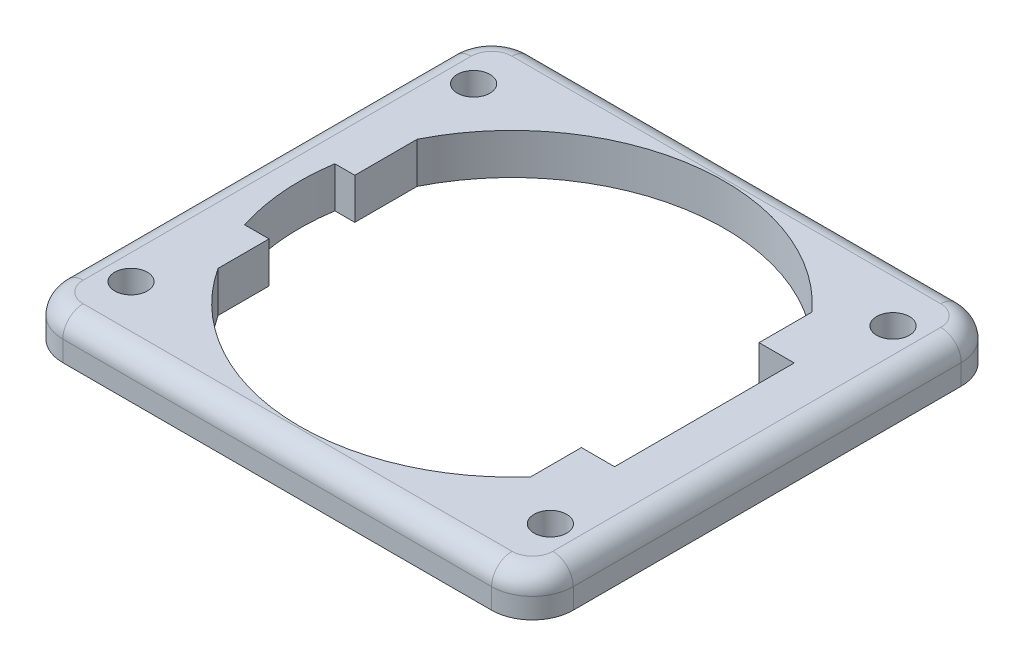
from build123d import *

# Parameters (mm, degrees)
SKETCH1_W           = 31.75
SKETCH1_H           = 29.21
BOSS_EXTRUDE1_DEPTH = 2.54
CUT_EXTRUDE1_DEPTH  = 22.720341848
SKETCH3_W           = 4.064
SKETCH3_H           = 4.263952617
SKETCH3_W_2         = 4.826
SKETCH3_H_2         = 10.541
SKETCH3_W_3         = 5.969
SKETCH3_H_3         = 4.464530762
SKETCH3_W_4         = 6.096
SKETCH3_H_4         = 4.639521707
BOSS_EXTRUDE2_DEPTH = 2.54
FILLET1_R           = 1.27
SKETCH5_R           = 1.016
CUT_EXTRUDE3_DEPTH  = 22.720341848
FILLET2_R           = 2.54


with BuildPart() as part:
    # Sketch1 → Boss-Extrude1 (new body)
    with BuildSketch(Plane(origin=(0, 0, 0), x_dir=(1, 0, 0), z_dir=(0, 1, 0))):
        Rectangle(SKETCH1_W, SKETCH1_H)
    extrude(amount=BOSS_EXTRUDE1_DEPTH)

    # Sketch2 → Cut-Extrude1 (cut, through all)
    with BuildSketch(Plane(origin=(0, 2.54, 0), x_dir=(1, 0, 0), z_dir=(0, 1, 0))):
        with BuildLine():
            Line((11.967686493, 5.588), (11.967686493, -5.588))
            ThreePointArc((11.967686493, -5.588), (-13.208, 0), (11.967686493, 5.588))
        make_face()
    extrude(amount=-CUT_EXTRUDE1_DEPTH, mode=Mode.SUBTRACT)

    # Sketch3 → Boss-Extrude2 (add)
    with BuildSketch(Plane(origin=(0, 2.54, 0), x_dir=(1, 0, 0), z_dir=(0, 1, 0))):
        with Locations((-13.843, 4.163976309)):
            Rectangle(SKETCH3_W, SKETCH3_H)
        with Locations((-13.462, -9.3345)):
            Rectangle(SKETCH3_W_2, SKETCH3_H_2)
        with Locations((12.8905, -7.820265381)):
            Rectangle(SKETCH3_W_3, SKETCH3_H_3)
        with Locations((12.827, 7.907760854)):
            Rectangle(SKETCH3_W_4, SKETCH3_H_4)
    extrude(amount=-BOSS_EXTRUDE2_DEPTH)

    # Fillet1
    fillet1_edges = [part.edges().sort_by_distance(p)[0] for p in [
        (15.875, 2.54, 0),
        (0, 2.54, -14.605),
        (-15.875, 2.54, 0),
        (0, 2.54, 14.605),
    ]]
    fillet(fillet1_edges, radius=FILLET1_R)

    # Sketch5 → Cut-Extrude3 (cut, through all)
    with BuildSketch(Plane.XZ):
        with Locations(Location((13.0429, -10.6553, 0), (0, 0, 270))):
            Circle(SKETCH5_R)
        with Locations(Location((-13.0429, -10.6553, 0), (0, 0, 90))):
            Circle(SKETCH5_R)
        with Locations(Location((-13.0429, 10.6553, 0), (0, 0, 270))):
            Circle(SKETCH5_R)
        with Locations(Location((13.0429, 10.6553, 0), (0, 0, 90))):
            Circle(SKETCH5_R)
    extrude(amount=-CUT_EXTRUDE3_DEPTH, mode=Mode.SUBTRACT)

    # Fillet2
    # the kernel refuses this fillet: 2.54 mm, written as the material it takes off along each edge
    with BuildSketch(Plane(origin=(13.335, 2.54, -12.065), x_dir=(1, 0, 0), z_dir=(0, 0, 1))) as fillet2_piece_1:
        with BuildLine():
            CenterArc((1.27, -1.27), 1.27, 0, 90)
            Line((2.54, -1.27), (2.54, 0))
            Line((2.54, 0), (1.27, 0))
        make_face()
    revolve(axis=Axis((13.335, 2.54, -12.065), (0, 1, 0)), revolution_arc=90, mode=Mode.SUBTRACT)
    with BuildSketch(Plane(origin=(13.335, 2.54, 12.065), x_dir=(0, 0, 1), z_dir=(-1, 0, 0))) as fillet2_piece_2:
        with BuildLine():
            CenterArc((1.27, -1.27), 1.27, 0, 90)
            Line((2.54, -1.27), (2.54, 0))
            Line((2.54, 0), (1.27, 0))
        make_face()
    revolve(axis=Axis((13.335, 2.54, 12.065), (0, 1, 0)), revolution_arc=90, mode=Mode.SUBTRACT)
    with BuildSketch(Plane(origin=(-13.335, 2.54, -12.065), x_dir=(0, 0, -1), z_dir=(1, 0, 0))) as fillet2_piece_3:
        with BuildLine():
            CenterArc((1.27, -1.27), 1.27, 0, 90)
            Line((2.54, -1.27), (2.54, 0))
            Line((2.54, 0), (1.27, 0))
        make_face()
    revolve(axis=Axis((-13.335, 2.54, -12.065), (0, 1, 0)), revolution_arc=90, mode=Mode.SUBTRACT)
    with BuildSketch(Plane(origin=(-13.335, 2.54, 12.065), x_dir=(-1, 0, 0), z_dir=(0, 0, -1))) as fillet2_piece_4:
        with BuildLine():
            CenterArc((1.27, -1.27), 1.27, 0, 90)
            Line((2.54, -1.27), (2.54, 0))
            Line((2.54, 0), (1.27, 0))
        make_face()
    revolve(axis=Axis((-13.335, 2.54, 12.065), (0, 1, 0)), revolution_arc=90, mode=Mode.SUBTRACT)
    with BuildSketch(Plane(origin=(-15.875, -6.35, 14.605), x_dir=(0, 0, -1), z_dir=(0, 1, 0)), Plane(origin=(-15.875, -6.35, -14.605), x_dir=(1, 0, 0), z_dir=(0, 1, 0))) as fillet2_piece_5:
        with BuildLine():
            CenterArc((FILLET2_R, -FILLET2_R), FILLET2_R, 90, 90)
            Line((0, -FILLET2_R), (0, 0))
            Line((0, 0), (FILLET2_R, 0))
        make_face()
    extrude(amount=8.89, mode=Mode.SUBTRACT)
    with BuildSketch(Plane(origin=(15.875, -6.35, -14.605), x_dir=(-1, 0, 0), z_dir=(0, 1, 0)), Plane(origin=(15.875, -6.35, 14.605), x_dir=(0, 0, -1), z_dir=(0, 1, 0))) as fillet2_piece_6:
        with BuildLine():
            CenterArc((FILLET2_R, FILLET2_R), FILLET2_R, 180, 90)
            Line((0, FILLET2_R), (0, 0))
            Line((0, 0), (FILLET2_R, 0))
        make_face()
    extrude(amount=8.89, mode=Mode.SUBTRACT)


solid = part.part
